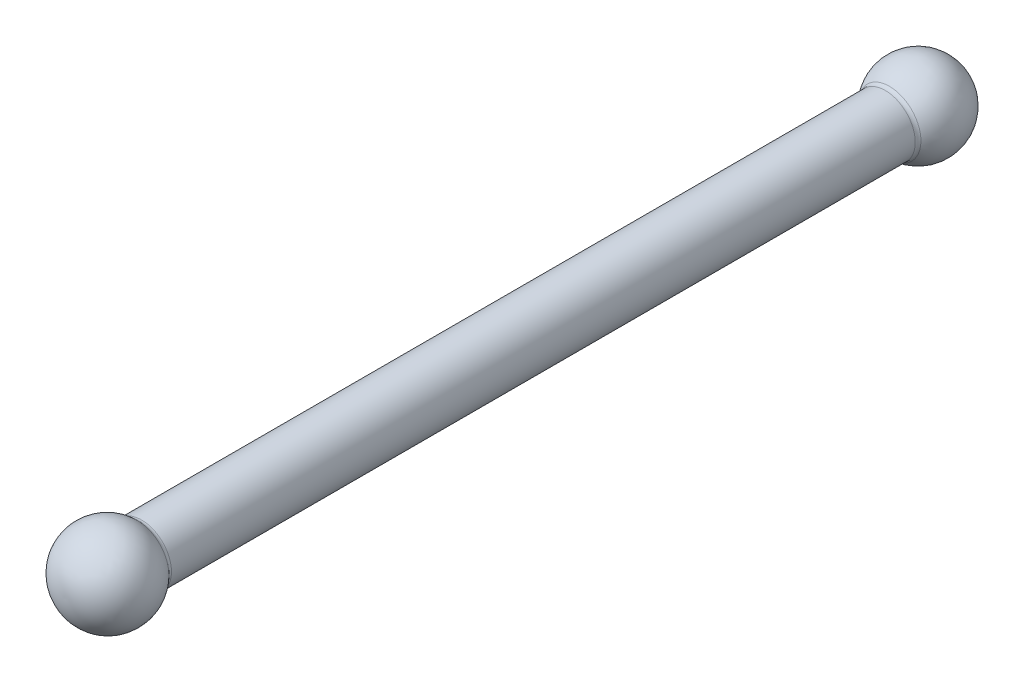
from build123d import *

# Parameters (mm, degrees)
SKETCH1_R              = 4.699
BOSS_EXTRUDE1_DEPTH    = 44.45
CUT_SWEEP1_PITCH       = 1.27
CUT_SWEEP1_HEIGHT      = 114.3
CUT_SWEEP1_RADIUS      = 4.699
CUT_SWEEP1_START_ANGLE = -90
SKETCH4_W              = 4.69845619
SKETCH4_H              = 16.911386709
SKETCH5_W              = 0.723886717
SKETCH5_H              = 17.397939395
SKETCH6_R              = 2.794
CUT_EXTRUDE1_DEPTH     = 6.35
CHAMFER1_SIZE          = 0.508
CHAMFER2_SIZE          = 0.79375
CHAMFER2_SIZE2         = 0.567023999
CHAMFER2_EDGE_2_SIZE   = 0.79375
CHAMFER2_EDGE_2_SIZE2  = 0.567023999
FILLET1_R              = 0.762
CHAMFER3_SIZE          = 0.3048
FILLET3_R              = 0.508


with BuildPart() as part:
    # Sketch1 → Boss-Extrude1 (new, symmetric)
    with BuildSketch(Plane(origin=(0, 0, 0), x_dir=(1, 0, 0), z_dir=(0, 1, 0))):
        with Locations(Location((0, 0, 0), (0, 0, 270))):
            Circle(SKETCH1_R)
    extrude(amount=BOSS_EXTRUDE1_DEPTH, both=True)

    # Cut-Sweep1: sweep along a helix
    with BuildLine() as cut_sweep1_path:
        add(Helix(CUT_SWEEP1_PITCH, CUT_SWEEP1_HEIGHT, CUT_SWEEP1_RADIUS, center=(0, 44.45, 0), direction=(0, -1, 0), mode=Mode.PRIVATE).rotate(Axis((0, 44.45, 0), (0, -1, 0)), CUT_SWEEP1_START_ANGLE))
    # Sketch3 → Cut-Sweep1 (sweep, cut)
    with BuildSketch(Plane.XY):
        Polygon((-3.99161, 44.606186444), (-3.99161, 44.288686444), (-4.698612835, 43.880498167), (-4.698612835, 45.014374721), align=None)
    sweep(path=cut_sweep1_path.line, is_frenet=True, mode=Mode.SUBTRACT)

    # Sketch4 → Revolve1 (revolve)
    with BuildSketch(Plane.XY):
        with Locations((-2.349228095, 52.905693355)):
            Rectangle(SKETCH4_W, SKETCH4_H)
    revolve(axis=Axis((0, 44.45, 0), (0, 1, 0)))

    # Sketch5 → Cut-Revolve1 (revolve, cut)
    with BuildSketch(Plane.XY):
        with Locations((-5.02318101, 53.148969698)):
            Rectangle(SKETCH5_W, SKETCH5_H)
    revolve(axis=Axis((0, 62.766926139, 0), (0, -1, 0)), mode=Mode.SUBTRACT)

    # Sketch6 → Cut-Extrude1 (cut, symmetric)
    with BuildSketch(Plane.XY):
        with Locations((0, 55.011386709)):
            Circle(SKETCH6_R)
    extrude(amount=CUT_EXTRUDE1_DEPTH, both=True, mode=Mode.SUBTRACT)

    # Chamfer1
    chamfer1_edges = [part.edges().sort_by_distance(p)[0] for p in [
        (4.661237651, 61.361386709, 0),
    ]]
    chamfer(chamfer1_edges, length=CHAMFER1_SIZE)

    # Chamfer2
    chamfer2_edges = [part.edges().sort_by_distance(p)[0] for p in [
        (-2.794, 55.011386706, -3.731045488),
    ]]
    chamfer2_side = [part.faces().sort_by_distance(p)[0] for p in [
        (4.661237651, 52.651693354, 0),
    ]]
    chamfer(chamfer2_edges, length=CHAMFER2_SIZE, length2=CHAMFER2_SIZE2, reference=chamfer2_side[0])

    # Chamfer2 edge 2
    chamfer2_edge_2_edges = [part.edges().sort_by_distance(p)[0] for p in [
        (-2.794, 55.011386706, 3.731045488),
    ]]
    chamfer2_edge_2_side = [part.faces().sort_by_distance(p)[0] for p in [
        (4.661237651, 52.651693354, 0),
    ]]
    chamfer(chamfer2_edge_2_edges, length=CHAMFER2_EDGE_2_SIZE, length2=CHAMFER2_EDGE_2_SIZE2, reference=chamfer2_edge_2_side[0])

    # Sketch7 → Revolve2 (revolve)
    with BuildSketch(Plane.XY):
        with BuildLine():
            Line((-3.98526, -44.45), (0, -44.45))
            Line((0, -44.45), (0, -48.645010112))
            Line((0, -48.645010112), (0, -53.407510112))
            ThreePointArc((0, -53.407510112), (-4.189252508, -50.910306929), (-3.98526, -46.0375))
            Line((-3.98526, -46.0375), (-3.98526, -44.45))
        make_face()
    revolve(axis=Axis((0, -47.823804308, 0), (0, -1, 0)))

    # Sketch8 → Cut-Revolve2 (revolve, cut)
    with BuildSketch(Plane.XY):
        Polygon((3.98526, -46.0375), (3.98526, -44.45), (5.088678737, -43.346581263), (5.088678737, -46.0375), align=None)
    revolve(axis=Axis((0, -56.16584847, 0), (0, 1, 0)), mode=Mode.SUBTRACT)


with BuildPart() as body_2:
    # Sketch9 → Revolve3 (revolve)
    with BuildSketch(Plane.XY):
        with BuildLine():
            Line((4.769366022, -47.907837304), (5.378396166, -47.907837304))
            ThreePointArc((5.378396166, -47.907837304), (5.424274511, -47.985297574), (5.470454774, -48.062578228))
            ThreePointArc((5.470454774, -48.062578228), (6.014262065, -49.72815682), (5.779486953, -51.464462974))
            ThreePointArc((5.779486953, -51.464462974), (6.076106552, -53.860794812), (8.21501488, -54.981268207))
            Line((8.21501488, -54.981268207), (8.855493066, -54.981268207))
            Line((8.855493066, -54.981268207), (8.855493066, -56.22448981))
            Line((8.855493066, -56.22448981), (0, -56.22448981))
            Line((0, -56.22448981), (0, -53.471010112))
            ThreePointArc((0, -53.471010112), (3.663868991, -51.786083179), (4.769366022, -47.907837304))
        make_face()
    revolve(axis=Axis((0, -48.645010112, 0), (0, -1, 0)))

    # Fillet1
    fillet1_edges = [body_2.edges().sort_by_distance(p)[0] for p in [
        (-5.378396166, -47.907837304, 0),
    ]]
    fillet(fillet1_edges, radius=FILLET1_R)

    # Chamfer3
    chamfer3_edges = [body_2.edges().sort_by_distance(p)[0] for p in [
        (-8.855493066, -54.981268207, 0),
    ]]
    chamfer(chamfer3_edges, length=CHAMFER3_SIZE)


with BuildPart() as body_3:
    # Sketch10 → Revolve4 (revolve)
    with BuildSketch(Plane(origin=(0, 0, 0), x_dir=(0, 0, -1), z_dir=(1, 0, 0)), mode=Mode.PRIVATE) as revolve4_sk:
        with BuildLine():
            Line((-25.078931212, 55.011386709), (49.420548196, 55.011386709))
            ThreePointArc((49.420548196, 55.011386709), (47.227520009, 58.284257823), (43.366572257, 57.500586709))
            Line((43.366572257, 57.500586709), (-18.922230923, 57.500586709))
            ThreePointArc((-18.922230923, 57.500586709), (-22.868342697, 58.402277998), (-25.078931212, 55.011386709))
        make_face()
    revolve(revolve4_sk.sketch.rotate(Axis((0, 55.011386709, 6.574e-06), (0, 0, -1)), 90), axis=Axis((0, 55.011386709, 6.574e-06), (0, 0, -1)))

    # Fillet3
    fillet3_edges = [body_3.edges().sort_by_distance(p)[0] for p in [
        (-2.4892, 55.011386709, 18.922230923),
        (-2.4892, 55.011386709, -43.366572257),
    ]]
    fillet(fillet3_edges, radius=FILLET3_R)


solid = body_3.part
